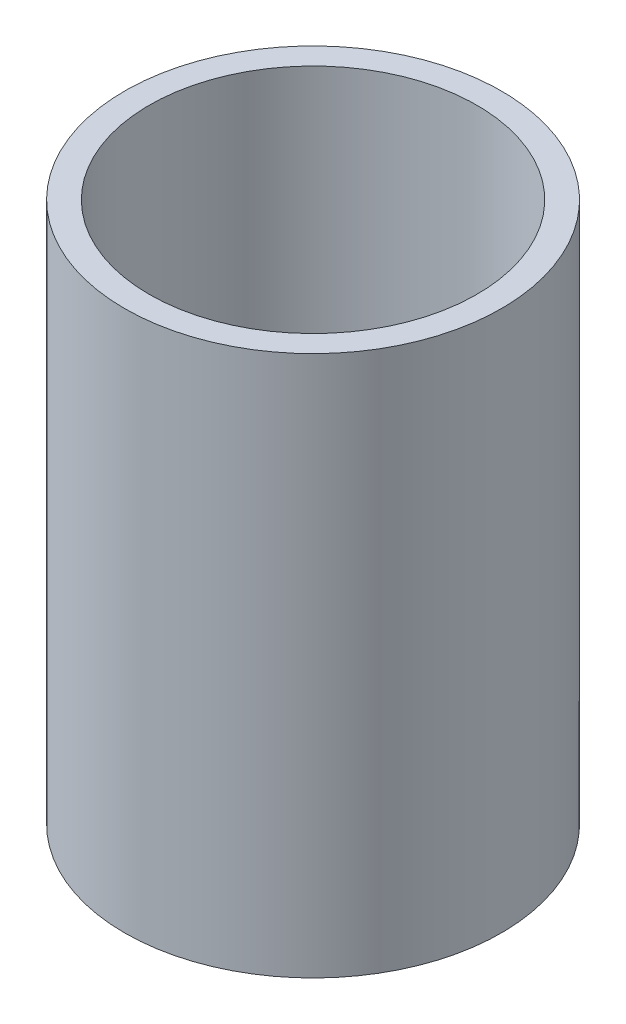
from build123d import *

# Parameters (mm, degrees)
SKETCH1_R           = 23
BOSS_EXTRUDE1_DEPTH = 66
SKETCH2_R           = 20
CUT_EXTRUDE1_DEPTH  = 17
CUT_EXTRUDE2_START  = -40
SKETCH5_R           = 20
CUT_EXTRUDE2_DEPTH  = 40
SKETCH4_R           = 2
CUT_EXTRUDE3_DEPTH  = 40


with BuildPart() as part:
    # Sketch1 → Boss-Extrude1 (new body)
    with BuildSketch(Plane(origin=(0, 0, 0), x_dir=(1, 0, 0), z_dir=(0, 1, 0))):
        Circle(SKETCH1_R)
    extrude(amount=BOSS_EXTRUDE1_DEPTH)

    # Sketch2 → Cut-Extrude1 (cut)
    with BuildSketch(Plane.XZ):
        Circle(SKETCH2_R)
    extrude(amount=-CUT_EXTRUDE1_DEPTH, mode=Mode.SUBTRACT)

    # Sketch5 → Cut-Extrude2 (cut)
    with BuildSketch(Plane(origin=(0, 66, 0), x_dir=(1, 0, 0), z_dir=(0, 1, 0)).offset(CUT_EXTRUDE2_START)):
        Circle(SKETCH5_R)
    extrude(amount=CUT_EXTRUDE2_DEPTH, mode=Mode.SUBTRACT)

    # Sketch4 → Cut-Extrude3 (cut)
    with BuildSketch(Plane.XZ.offset(-17)):
        Circle(SKETCH4_R)
    extrude(amount=-CUT_EXTRUDE3_DEPTH, mode=Mode.SUBTRACT)


solid = part.part
